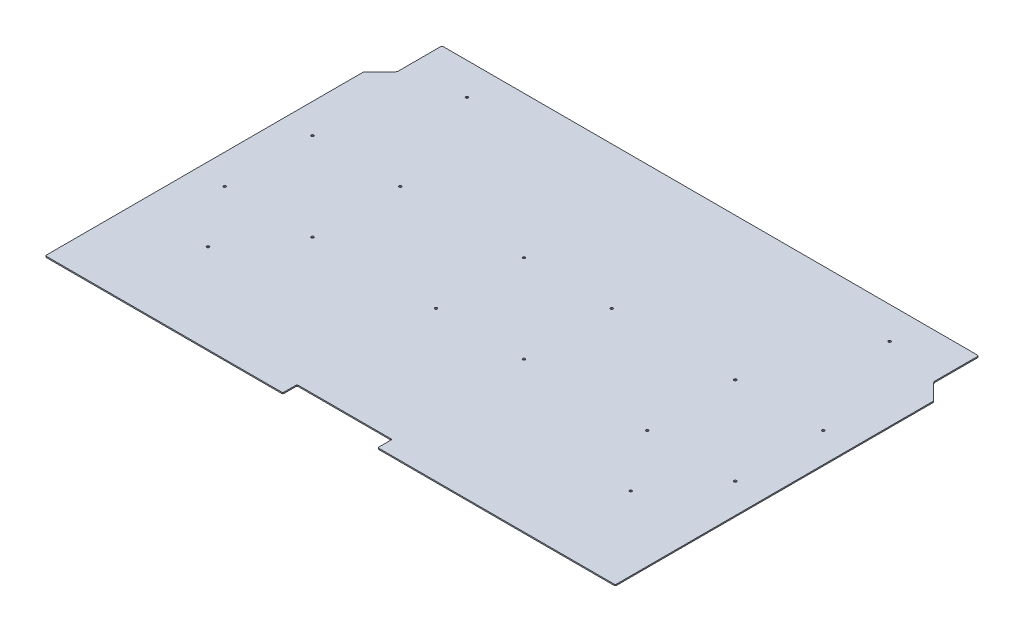
from build123d import *

# Parameters (mm, degrees)
BOSS_EXTRUDE1_DEPTH              = 3.175
F_17_64_0_26563_DIAMETER_HOLE1_D = 6.747002
SKETCH5_W                        = 254
SKETCH5_H                        = 38.1
CUT_EXTRUDE1_DEPTH               = 916.815527617
FILLET1_R                        = 3.175


with BuildPart() as part:
    # Sketch1 → Boss-Extrude1 (new body)
    with BuildSketch(Plane(origin=(0, 0, 0), x_dir=(1, 0, 0), z_dir=(0, 1, 0))):
        with BuildLine():
            Line((-717.55, 504.825), (-717.55, 392.610512242))
            ThreePointArc((-717.55, 392.610512242), (-718.516729937, 387.750432651), (-721.269743879, 383.630256121))
            Line((-721.269743879, 383.630256121), (-761.07006403, 343.82993597))
            ThreePointArc((-761.07006403, 343.82993597), (-761.758317516, 342.799891837), (-762, 341.584871939))
            Line((-762, 341.584871939), (-762, -504.825))
            ThreePointArc((-762, -504.825), (-761.07006403, -507.07006403), (-758.825, -508))
            Line((-758.825, -508), (758.825, -508))
            ThreePointArc((758.825, -508), (761.07006403, -507.07006403), (762, -504.825))
            Line((762, -504.825), (762, 341.584871939))
            ThreePointArc((762, 341.584871939), (761.758317516, 342.799891837), (761.07006403, 343.82993597))
            Line((761.07006403, 343.82993597), (721.269743879, 383.630256121))
            ThreePointArc((721.269743879, 383.630256121), (718.516729937, 387.750432651), (717.55, 392.610512242))
            Line((717.55, 392.610512242), (717.55, 504.825))
            ThreePointArc((717.55, 504.825), (716.62006403, 507.07006403), (714.375, 508))
            Line((714.375, 508), (-714.375, 508))
            ThreePointArc((-714.375, 508), (-716.62006403, 507.07006403), (-717.55, 504.825))
        make_face()
    extrude(amount=BOSS_EXTRUDE1_DEPTH)

    # 17/64 (0.26563) Diameter Hole1 (through all)
    with Locations(Plane(origin=(0, 3.175, 0), x_dir=(1, 0, 0), z_dir=(0, 1, 0))):
        with Locations((-565.15, 422.275), (565.15, 422.275), (565.15, -269.875), (-565.15, -269.875), (-682.625, 127), (-447.675, 127), (-682.625, -107.95), (-447.675, -107.95), (-117.475, 127), (117.475, 127), (-117.475, -107.95), (117.475, -107.95), (447.675, 127), (682.625, 127), (447.675, -107.95), (682.625, -107.95)):
            Hole(F_17_64_0_26563_DIAMETER_HOLE1_D / 2)

    # Sketch5 → Cut-Extrude1 (cut, through all)
    with BuildSketch(Plane(origin=(0, 3.175, 0), x_dir=(1, 0, 0), z_dir=(0, 1, 0))):
        with Locations((0, -488.95)):
            Rectangle(SKETCH5_W, SKETCH5_H)
    extrude(amount=-CUT_EXTRUDE1_DEPTH, mode=Mode.SUBTRACT)

    # Fillet1
    fillet1_edges = [part.edges().sort_by_distance(p)[0] for p in [
        (127, 1.5875, 508),
        (127, 1.5875, 469.9),
        (-127, 1.5875, 469.9),
        (-127, 1.5875, 508),
    ]]
    fillet(fillet1_edges, radius=FILLET1_R)


solid = part.part
